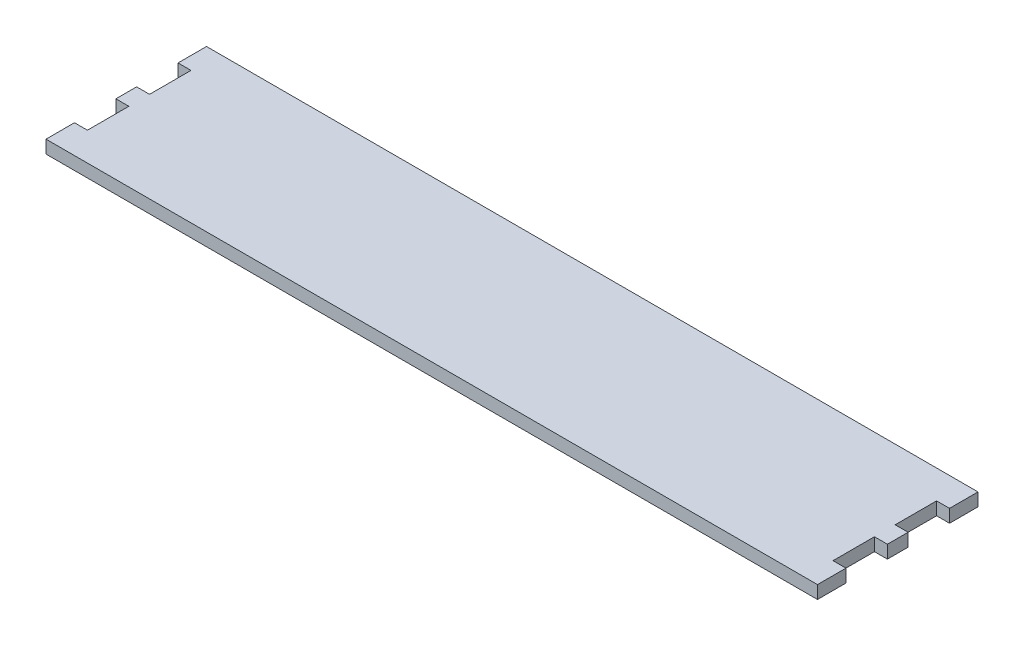
from build123d import *

# Parameters (mm, degrees)
BOSS_EXTRUDE1_DEPTH = 3.175


with BuildPart() as part:
    # Sketch1 → Boss-Extrude1 (new body)
    with BuildSketch(Plane(origin=(0, 0, 0), x_dir=(1, 0, 0), z_dir=(0, 1, 0))):
        Polygon((-42.852622222, 17.463911111), (146.377377778, 17.463911111), (146.377377778, 10.478911111), (143.202377778, 10.478911111), (143.202377778, 0.318911111), (146.377377778, 0.318911111), (146.377377778, -4.761088889), (143.202377778, -4.761088889), (143.202377778, -14.921088889), (146.377377778, -14.921088889), (146.377377778, -21.906088889), (-42.852622222, -21.906088889), (-42.852622222, -14.921088889), (-39.677622222, -14.921088889), (-39.677622222, -4.761088889), (-42.852622222, -4.761088889), (-42.852622222, 0.318911111), (-39.677622222, 0.318911111), (-39.677622222, 10.478911111), (-42.852622222, 10.478911111), align=None)
    extrude(amount=BOSS_EXTRUDE1_DEPTH)


solid = part.part
